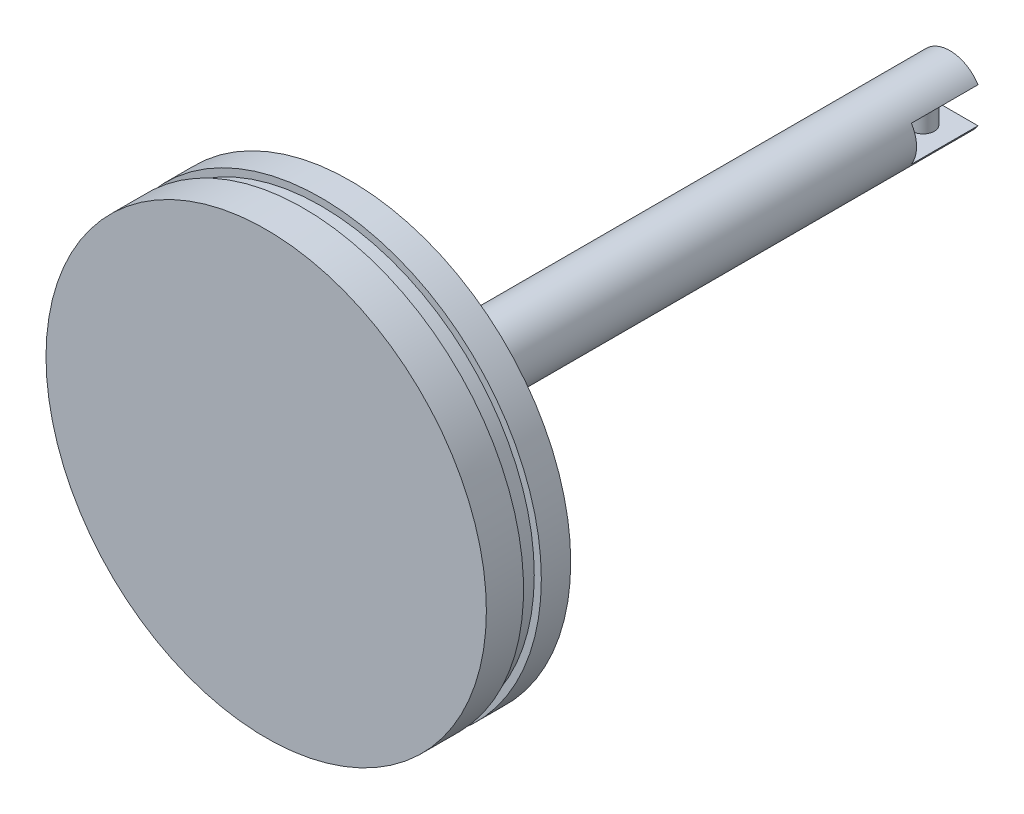
from build123d import *

# Parameters (mm, degrees)
SKETCH1_R           = 49.6
BOSS_EXTRUDE1_DEPTH = 3
SKETCH2_R           = 49.6
SKETCH2_R_2         = 46
BOSS_EXTRUDE2_DEPTH = 15
SKETCH3_R           = 49.6
BOSS_EXTRUDE3_DEPTH = 4
SKETCH4_R           = 2.5
SKETCH4_R_2         = 5
BOSS_EXTRUDE4_DEPTH = 16
SKETCH5_R           = 7.5
BOSS_EXTRUDE5_DEPTH = 135
SKETCH6_W           = 4
SKETCH6_H           = 2.877326051
SKETCH7_W           = 21.216623492
SKETCH7_H           = 8
CUT_EXTRUDE1_DEPTH  = 15
SKETCH8_R           = 2.5
BOSS_EXTRUDE6_DEPTH = 10


with BuildPart() as part:
    # Sketch1 → Boss-Extrude1 (new body)
    with BuildSketch(Plane.XY):
        Circle(SKETCH1_R)
    extrude(amount=BOSS_EXTRUDE1_DEPTH)

    # Sketch2 → Boss-Extrude2 (add)
    with BuildSketch(Plane.XY):
        Circle(SKETCH2_R)
        Circle(SKETCH2_R_2, mode=Mode.SUBTRACT)
    extrude(amount=BOSS_EXTRUDE2_DEPTH)

    # Sketch3 → Boss-Extrude3 (add)
    with BuildSketch(Plane.XY.offset(15)):
        Circle(SKETCH3_R)
    extrude(amount=BOSS_EXTRUDE3_DEPTH)

    # Sketch4 → Boss-Extrude4 (add)
    with BuildSketch(Plane.XY.offset(3)):
        with Locations((-35.987639667, -3.679667055)):
            Circle(SKETCH4_R)
        with Locations((-20.971152057, -26.371770497)):
            Circle(SKETCH4_R)
        with Locations((10.797391405, -30.746904789)):
            Circle(SKETCH4_R)
        with Locations((29.028310122, -5.229746582)):
            Circle(SKETCH4_R)
        with Locations((17.402549466, 21.919229393)):
            Circle(SKETCH4_R)
        with Locations((-12.555375397, 26.332978184)):
            Circle(SKETCH4_R)
        Circle(SKETCH4_R_2)
    extrude(amount=BOSS_EXTRUDE4_DEPTH)

    # Sketch5 → Boss-Extrude5 (add)
    with BuildSketch(Plane.XY):
        Circle(SKETCH5_R)
    extrude(amount=-BOSS_EXTRUDE5_DEPTH)

    # Sketch6 → Cut-Revolve1 (revolve, cut)
    with BuildSketch(Plane(origin=(0, 0, 0), x_dir=(0, 0, -1), z_dir=(1, 0, 0))):
        with Locations((-8.620257655, -49.449045314)):
            Rectangle(SKETCH6_W, SKETCH6_H)
    revolve(axis=Axis((0, 0, 0), (0, 0, 1)), mode=Mode.SUBTRACT)

    # Sketch7 → Cut-Extrude1 (cut)
    with BuildSketch(Plane(origin=(0, 0, -135), x_dir=(-1, 0, 0), z_dir=(0, 0, -1))):
        Rectangle(SKETCH7_W, SKETCH7_H)
    extrude(amount=-CUT_EXTRUDE1_DEPTH, mode=Mode.SUBTRACT)

    # Sketch8 → Boss-Extrude6 (add)
    with BuildSketch(Plane(origin=(0, -4, 0), x_dir=(1, 0, 0), z_dir=(0, 1, 0))):
        with Locations((0, 129)):
            Circle(SKETCH8_R)
    extrude(amount=BOSS_EXTRUDE6_DEPTH)


solid = part.part
